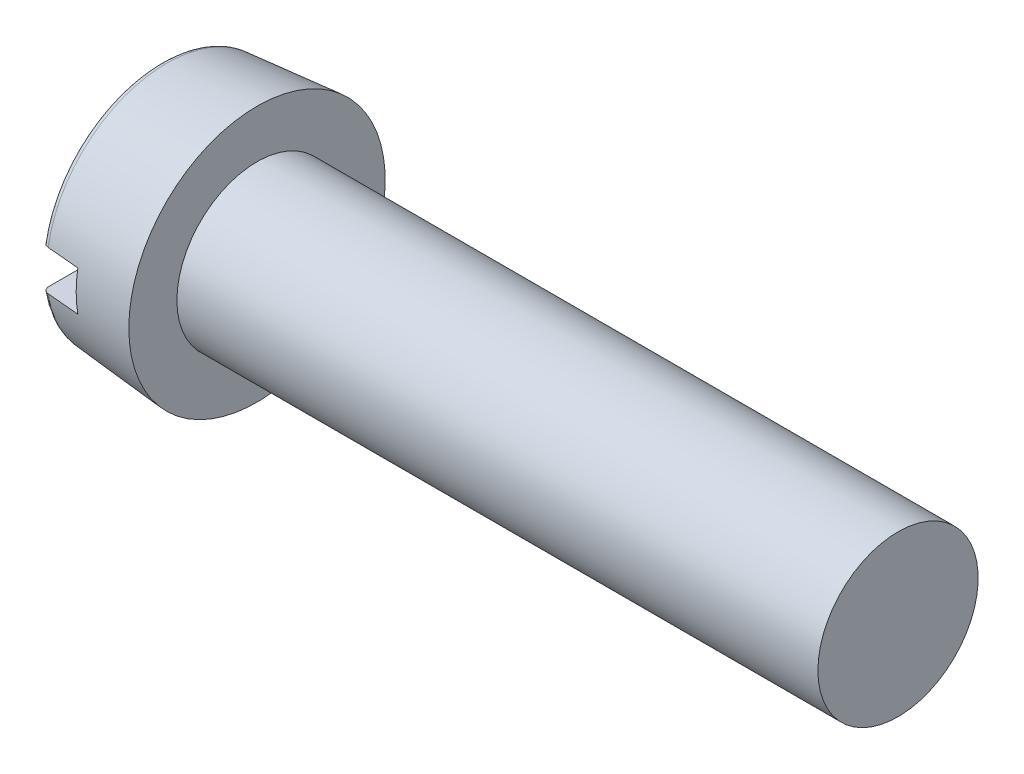
from build123d import *

# Parameters (mm, degrees)
FILLET2_R  = 0.4
SKETCH2_W  = 16
SKETCH2_H  = 2.5
SLOT_DEPTH = 2.4


with BuildPart() as part:
    # BodySke → Base-Revolve (revolve)
    with BuildSketch(Plane.XY):
        Polygon((6, 5), (6, 8), (0, 7.475068019), (0, 0), (46, 0), (46, 5), align=None)
    revolve(axis=Axis((-25.4, 0, 0), (1, 0, 0)))

    # Fillet2
    fillet2_edges = [part.edges().sort_by_distance(p)[0] for p in [
        (0, -7.475068019, 0),
    ]]
    fillet(fillet2_edges, radius=FILLET2_R)

    # Sketch2 → Slot (cut)
    with BuildSketch(Plane(origin=(0, 0, 0), x_dir=(0, 0, -1), z_dir=(1, 0, 0))):
        Rectangle(SKETCH2_W, SKETCH2_H)
    extrude(amount=SLOT_DEPTH, mode=Mode.SUBTRACT)


solid = part.part
